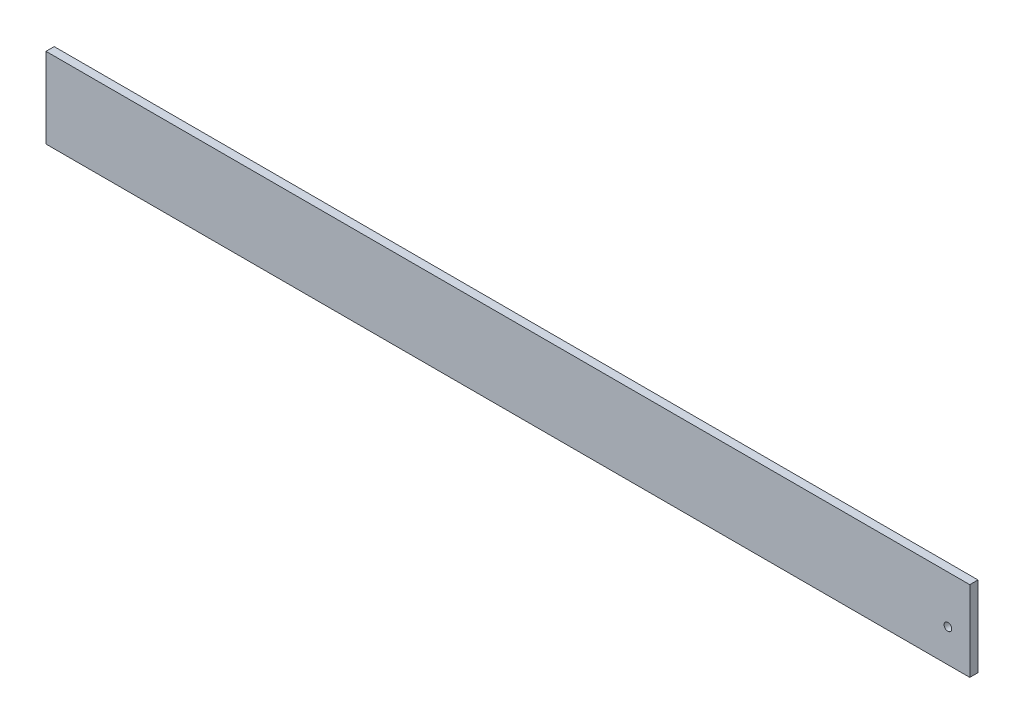
from build123d import *

# Parameters (mm, degrees)
SKETCH1_W           = 506
SKETCH1_H           = 44
SKETCH1_R           = 2.1
BOSS_EXTRUDE1_DEPTH = 4.5


with BuildPart() as part:
    # Sketch1 → Boss-Extrude1 (new body)
    with BuildSketch(Plane.XY):
        Rectangle(SKETCH1_W, SKETCH1_H)
        with Locations((241, -4)):
            Circle(SKETCH1_R, mode=Mode.SUBTRACT)
    extrude(amount=BOSS_EXTRUDE1_DEPTH)


solid = part.part
